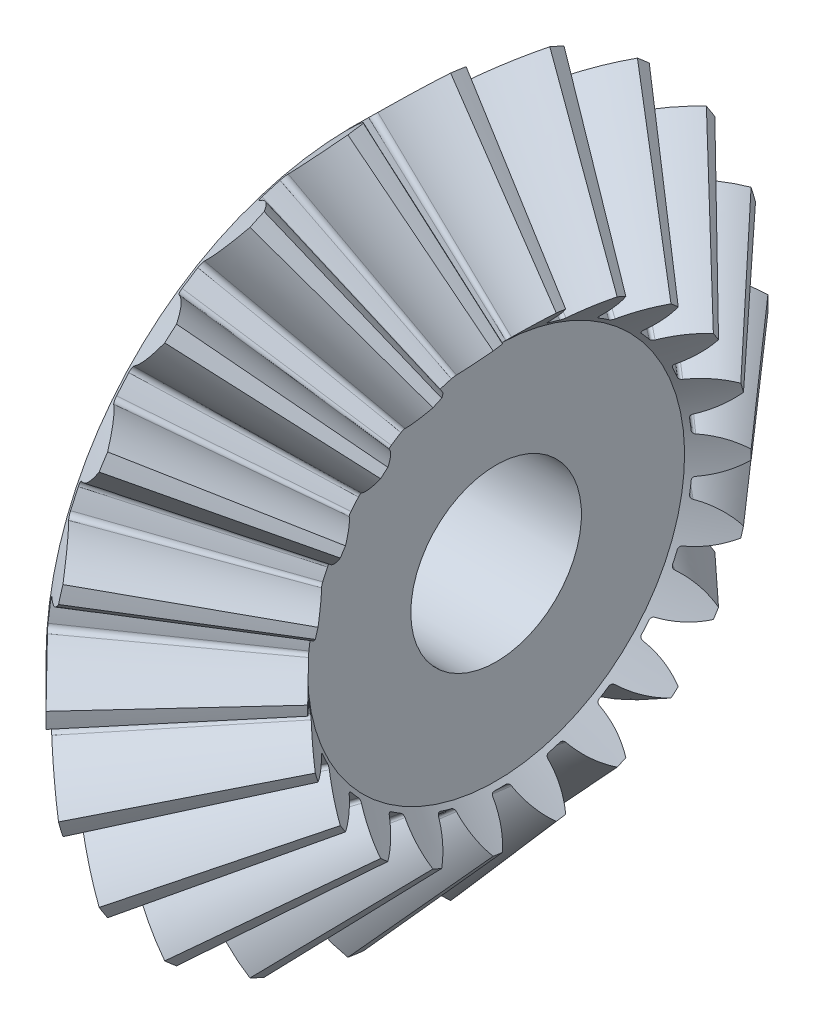
from build123d import *

# Parameters (mm, degrees)
TEETHCUTS_COUNT = 22
TEETHCUTS_ANGLE = 343.636363636
HUBSKE_R        = 7.5
HUB_DEPTH       = 0.0001016
BORSKE_R        = 4.15
BORE_DEPTH      = 18.076015039


with BuildPart() as part:
    # BasProSke → Base-Revolve (revolve)
    with BuildSketch(Plane(origin=(0, 0, 0), x_dir=(1, 0, 0), z_dir=(0, 1, 0)), mode=Mode.PRIVATE) as base_revolve_sk:
        Polygon((0, 0), (0, 14.924035763), (2.636624413, 17.560660171), (8.591494528, 10.787608225), (6.971801935, 9.167915636), (6.971801935, 0), align=None)
    revolve(base_revolve_sk.sketch.rotate(Axis((-10, 0, 0), (1, 0, 0)), 180), axis=Axis((-10, 0, 0), (1, 0, 0)))

    # ToothCut: read off the stored shape, not the designer's step
    # ToothCut: loft between two sections, ruled curve by curve
    toothcut_from = [
        Edge.make_bspline([(18.082098387, 0.006134148, -0.009275457), (18.07784036, 0.00187612, -0.014907403), (18.072039145, -0.003925095, -0.014087509), (18.068653428, -0.007310812, -0.007375262)], [0, 0, 0, 0, 1, 1, 1, 1], 3, [1, 0.772537019, 0.772537019, 1]),
        Edge.make_bspline([(18.068653428, -0.007310812, 0.007375262), (18.072039145, -0.003925095, 0.014087509), (18.07784036, 0.00187612, 0.014907403), (18.082098387, 0.006134148, 0.009275457)], [0, 0, 0, 0, 1, 1, 1, 1], 3, [1, 0.772537019, 0.772537019, 1]),
        Edge.make_bspline([(18.068653428, -0.007310812, -0.007375262), (18.06817062, -0.00779362, -0.006418087), (18.067785821, -0.008178419, -0.005375854), (18.067506392, -0.008457848, -0.004268501)], [0, 0, 0, 0, 1, 1, 1, 1], 3, [1, 0.993623092, 0.993623092, 1]),
        Edge.make_bspline([(18.067506392, -0.008457848, 0.004268501), (18.067785821, -0.008178419, 0.005375854), (18.06817062, -0.00779362, 0.006418087), (18.068653428, -0.007310812, 0.007375262)], [0, 0, 0, 0, 1, 1, 1, 1], 3, [1, 0.993623092, 0.993623092, 1]),
        Edge.make_bspline([(18.067506392, -0.008457848, -0.004268501), (18.066802802, -0.009161438, -0.001480242), (18.066802802, -0.009161438, 0.001480242), (18.067506392, -0.008457848, 0.004268501)], [0, 0, 0, 0, 1, 1, 1, 1], 3, [1, 0.961216951, 0.961216951, 1]),
        Edge.make_line((18.082098387, 0.006134148, 0.009275457), (18.082098387, 0.006134148, -0.009275457)),
    ]
    toothcut_to = [
        Edge.make_bspline([(2.781352887, 17.705388644, -2.383135833), (2.132498331, 17.05653409, -1.532918876), (1.342545241, 16.266581002, -0.970032052), (0.473268726, 15.397304488, -0.738493666)], [0, 0, 0, 0, 1, 1, 1, 1], 3, [1, 0.973933005, 0.973933005, 1]),
        Edge.make_bspline([(0.473268726, 15.397304488, 0.738493666), (1.342545241, 16.266581002, 0.970032052), (2.132498331, 17.05653409, 1.532918876), (2.781352887, 17.705388644, 2.383135833)], [0, 0, 0, 0, 1, 1, 1, 1], 3, [1, 0.973933005, 0.973933005, 1]),
        Edge.make_bspline([(0.473268726, 15.397304488, -0.738493666), (0.371801263, 15.295837026, -0.711467038), (0.307121152, 15.231156914, -0.597648338), (0.310290169, 15.234325932, -0.451697507)], [0, 0, 0, 0, 1, 1, 1, 1], 3, [1, 0.839921023, 0.839921023, 1]),
        Edge.make_bspline([(0.310290169, 15.234325932, 0.451697507), (0.307121152, 15.231156914, 0.597648338), (0.371801263, 15.295837026, 0.711467038), (0.473268726, 15.397304488, 0.738493666)], [0, 0, 0, 0, 1, 1, 1, 1], 3, [1, 0.839921023, 0.839921023, 1]),
        Edge.make_bspline([(0.310290169, 15.234325932, -0.451697507), (0.316827588, 15.24086335, -0.15061314), (0.316827588, 15.24086335, 0.15061314), (0.310290169, 15.234325932, 0.451697507)], [0, 0, 0, 0, 1, 1, 1, 1], 3, [1, 0.999685922, 0.999685922, 1]),
        Edge.make_line((2.781352887, 17.705388644, 2.383135833), (2.781352887, 17.705388644, -2.383135833)),
    ]
    toothcut = Solid(Shell([*[Face.make_surface_from_curves(toothcut_from[k], toothcut_to[k]) for k in range(6)], Face(Wire(toothcut_from)), Face(Wire(toothcut_to))]))
    add(toothcut, mode=Mode.SUBTRACT)

    # TeethCuts: ToothCut ×22 about axis
    teethcuts_axis = Axis((-10, 0, 0), (1, 0, 0))
    for i in range(1, TEETHCUTS_COUNT):
        add(toothcut.rotate(teethcuts_axis, i * TEETHCUTS_ANGLE / (TEETHCUTS_COUNT - 1)), mode=Mode.SUBTRACT)

    # HubSke → Hub (add)
    with BuildSketch(Plane.ZY):
        with Locations(Location((0, 0, 0), (0, 0, 180))):
            Circle(HUBSKE_R)
    extrude(amount=HUB_DEPTH)

    # BorSke → Bore (cut, symmetric)
    with BuildSketch(Plane(origin=(0, 0, 0), x_dir=(0, 0, -1), z_dir=(1, 0, 0))):
        with Locations(Location((0, 0, 0), (0, 0, 180))):
            Circle(BORSKE_R)
    extrude(amount=BORE_DEPTH, both=True, mode=Mode.SUBTRACT)


solid = part.part
